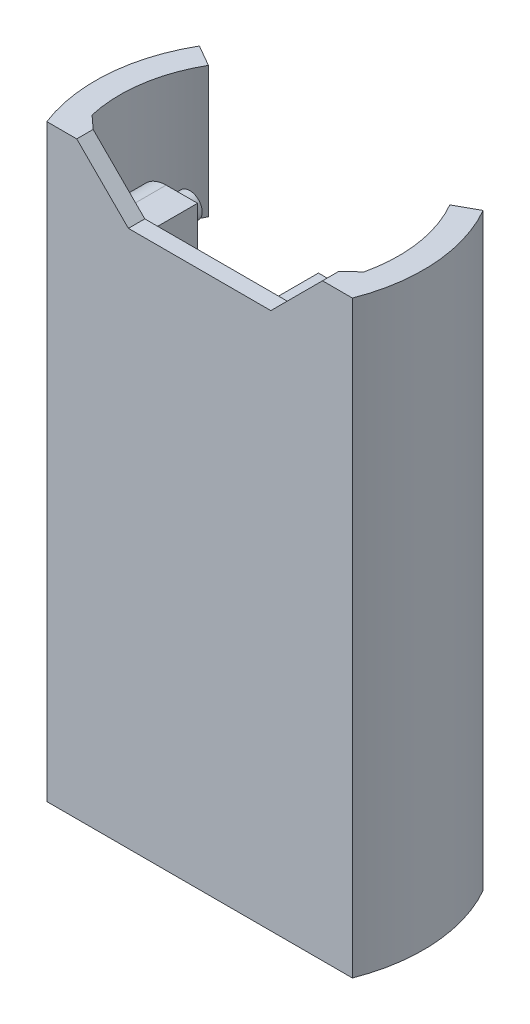
from build123d import *

# Parameters (mm, degrees)
BOSS_EXTRUDE1_DEPTH = 1.524
SKETCH1_3_R         = 1.2
BOSS_EXTRUDE2_DEPTH = 4.064
SKETCH1_4_R         = 1
SKETCH1_4_R_2       = 1.2
BOSS_EXTRUDE3_DEPTH = 6.35
SKETCH3_W           = 9.525
SKETCH3_H           = 3.175
BOSS_EXTRUDE4_DEPTH = 1.524
CHAMFER1_SIZE       = 1.524
BOSS_EXTRUDE5_START = -57
BOSS_EXTRUDE5_DEPTH = 57
CUT_EXTRUDE1_DEPTH  = 35.815330499
SKETCH6_W           = 17.468754951
SKETCH6_H           = 9.652
CUT_EXTRUDE2_DEPTH  = 35.815330499
BOSS_EXTRUDE6_DEPTH = 10.16


with BuildPart() as part:
    # Sketch1 → Boss-Extrude1 (new body)
    with BuildSketch(Plane(origin=(0, 0, 0), x_dir=(-1, 0, 0), z_dir=(0, 0, 1))):
        Polygon((11.893796958, -28.509907181), (11.893796958, 28.490092819), (-11.893796958, 28.490092819), (-11.893796958, -28.509907181), (-6.893796958, -23.509907181), (6.893796958, -23.509907181), align=None)
    extrude(amount=BOSS_EXTRUDE1_DEPTH)

    # Sketch1<3> → Boss-Extrude2 (add)
    # profile 1 of 4: a face of its own
    with BuildSketch(Plane(origin=(0, 0, 0), x_dir=(-1, 0, 0), z_dir=(0, 0, 1))):
        with BuildLine():
            ThreePointArc((-8.89, -17.709907181), (-11.69, -20.509907181), (-8.89, -23.309907181))
            Line((-8.89, -23.309907181), (-5.85, -23.309907181))
            Line((-5.85, -23.309907181), (-5.85, -17.709907181))
            Line((-5.85, -17.709907181), (-8.89, -17.709907181))
        make_face()
        with Locations(Location((-8.89, -20.509907181, 0), (0, 0, 180))):
            Circle(SKETCH1_3_R, mode=Mode.SUBTRACT)
    # profile 2 of 4: a face of its own
    with BuildSketch(Plane(origin=(0, 0, 0), x_dir=(-1, 0, 0), z_dir=(0, 0, 1))):
        with BuildLine():
            ThreePointArc((8.89, -23.309907181), (11.69, -20.509907181), (8.89, -17.709907181))
            Line((8.89, -17.709907181), (5.85, -17.709907181))
            Line((5.85, -17.709907181), (5.85, -23.309907181))
            Line((5.85, -23.309907181), (8.89, -23.309907181))
        make_face()
    # profile 3 of 4: a face of its own
    with BuildSketch(Plane(origin=(0, 0, 0), x_dir=(-1, 0, 0), z_dir=(0, 0, 1))):
        with BuildLine():
            ThreePointArc((7.89, 23.138861301), (11.19, 25.210092819), (7.89, 27.281324337))
            Line((7.89, 27.281324337), (7.89, 23.138861301))
        make_face()
    # profile 4 of 4: a face of its own
    with BuildSketch(Plane(origin=(0, 0, 0), x_dir=(-1, 0, 0), z_dir=(0, 0, 1))):
        with BuildLine():
            ThreePointArc((-7.89, 27.281324337), (-11.19, 25.210092819), (-7.89, 23.138861301))
            Line((-7.89, 23.138861301), (-7.89, 27.281324337))
        make_face()
    extrude(amount=-BOSS_EXTRUDE2_DEPTH)

    # Sketch1<4> → Boss-Extrude3 (add)
    with BuildSketch(Plane(origin=(0, 0, 0), x_dir=(-1, 0, 0), z_dir=(0, 0, 1))):
        with Locations(Location((8.89, 25.210092819, 0), (0, 0, 180))):
            Circle(SKETCH1_4_R)
        with Locations(Location((-8.89, -20.509907181, 0), (0, 0, 180))):
            Circle(SKETCH1_4_R_2)
        with Locations(Location((-8.89, 25.210092819, 0), (0, 0, 180))):
            Circle(SKETCH1_4_R)
        with Locations(Location((8.89, -20.509907181, 0), (0, 0, 180))):
            Circle(SKETCH1_4_R_2)
    extrude(amount=-BOSS_EXTRUDE3_DEPTH)

    # Sketch3 → Boss-Extrude4 (add)
    with BuildSketch(Plane(origin=(0, 0, 0), x_dir=(-1, 0, 0), z_dir=(0, 0, -1))):
        with Locations((0, 16.122407181)):
            Rectangle(SKETCH3_W, SKETCH3_H)
    extrude(amount=BOSS_EXTRUDE4_DEPTH)

    # Chamfer1
    chamfer1_edges = [part.edges().sort_by_distance(p)[0] for p in [
        (0, 14.534907181, -1.524),
    ]]
    chamfer(chamfer1_edges, length=CHAMFER1_SIZE - 0.0001)  # a hair under: the kernel refuses the full size

    # Sketch4 → Boss-Extrude5 (add)
    with BuildSketch(Plane.XZ.offset(28.490092819).offset(BOSS_EXTRUDE5_START)):
        with BuildLine():
            ThreePointArc((13.155591368, -1.15943863), (13.351412917, -6.186799511), (11.692856631, -10.936735779))
            Line((11.692856631, -10.936735779), (13.772671764, -12.084238841))
            ThreePointArc((13.772671764, -12.084238841), (15.831522609, -5.363460963), (14.786599753, 1.5875))
            Line((14.786599753, 1.5875), (-14.786599753, 1.5875))
            ThreePointArc((-14.786599753, 1.5875), (-15.829296194, -5.393105445), (-13.743006885, -12.135765541))
            Line((-13.743006885, -12.135765541), (-11.685926468, -10.948731172))
            ThreePointArc((-11.685926468, -10.948731172), (-13.350386295, -6.193649708), (-13.155591368, -1.15943863))
            Line((-13.155591368, -1.15943863), (-11.893796958, 0))
            Line((-11.893796958, 0), (11.893796958, 0))
            Line((11.893796958, 0), (13.155591368, -1.15943863))
        make_face()
    extrude(amount=BOSS_EXTRUDE5_DEPTH)

    # Sketch5 → Cut-Extrude1 (cut, through all)
    with BuildSketch(Plane(origin=(0, 0, 0), x_dir=(-1, 0, 0), z_dir=(0, 0, -1))):
        Polygon((11.893796958, 28.509907181), (-11.893796958, 28.509907181), (-6.893796958, 23.509907181), (6.893796958, 23.509907181), align=None)
    extrude(amount=-CUT_EXTRUDE1_DEPTH, mode=Mode.SUBTRACT)

    # Sketch6 → Cut-Extrude2 (cut, through all)
    with BuildSketch(Plane(origin=(0, 0, 0), x_dir=(0, 0, -1), z_dir=(1, 0, 0))):
        with Locations((11.782377476, 10.983907181)):
            Rectangle(SKETCH6_W, SKETCH6_H)
    extrude(amount=-CUT_EXTRUDE2_DEPTH, mode=Mode.SUBTRACT)

    # Sketch7 → Boss-Extrude6 (add)
    with BuildSketch(Plane(origin=(0, 0, 0), x_dir=(1, 0, 0), z_dir=(0, 1, 0))):
        with BuildLine():
            Line((-13.334610111, 6.296055118), (-11.933690156, 7.696975073))
            Line((-11.933690156, 7.696975073), (-10.802177885, 6.565462802))
            Line((-10.802177885, 6.565462802), (-13.496254721, 3.871385965))
            ThreePointArc((-13.496254721, 3.871385965), (-13.394733651, 2.5067686), (-13.155591368, 1.15943863))
            Line((-13.155591368, 1.15943863), (-11.893796958, 0))
            Line((-11.893796958, 0), (11.893796958, 0))
            Line((11.893796958, 0), (13.155591368, 1.15943863))
            ThreePointArc((13.155591368, 1.15943863), (13.394733651, 2.5067686), (13.496254721, 3.871385965))
            Line((13.496254721, 3.871385965), (10.802177885, 6.565462802))
            Line((10.802177885, 6.565462802), (11.933690156, 7.696975073))
            Line((11.933690156, 7.696975073), (13.334610111, 6.296055118))
            ThreePointArc((13.334610111, 6.296055118), (12.727038231, 8.691857223), (11.692856631, 10.936735779))
            Line((11.692856631, 10.936735779), (13.772671764, 12.084238841))
            ThreePointArc((13.772671764, 12.084238841), (15.831522609, 5.363460963), (14.786599753, -1.5875))
            Line((14.786599753, -1.5875), (-14.786599753, -1.5875))
            ThreePointArc((-14.786599753, -1.5875), (-15.829296194, 5.393105445), (-13.743006885, 12.135765541))
            Line((-13.743006885, 12.135765541), (-11.685926468, 10.948731172))
            ThreePointArc((-11.685926468, 10.948731172), (-12.724726374, 8.698386731), (-13.334610111, 6.296055118))
        make_face()
    extrude(amount=-BOSS_EXTRUDE6_DEPTH)


solid = part.part
